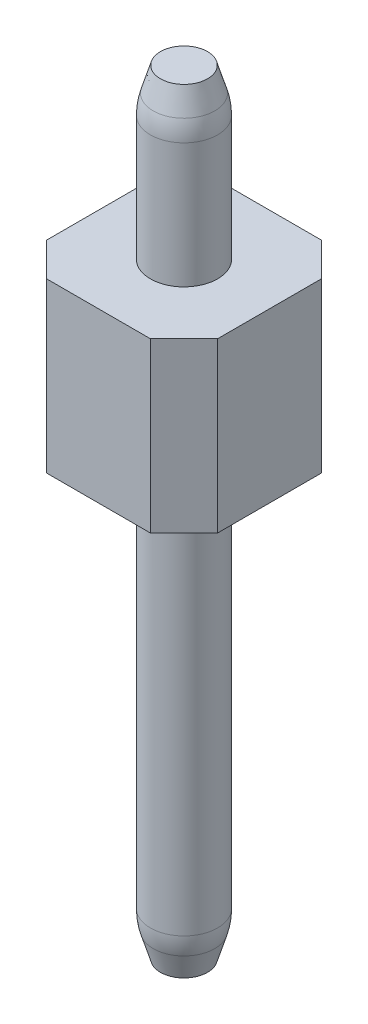
from build123d import *
from OCP.BRepFilletAPI import BRepFilletAPI_MakeChamfer

# Parameters (mm, degrees)
SKETCH1_R               = 0.5
BOSS_EXTRUDE1_DEPTH     = 11.5
BOSS_EXTRUDE1_2_DEPTH   = 11.5
BOSS_EXTRUDE1_3_DEPTH   = 11.5
BOSS_EXTRUDE1_4_DEPTH   = 11.5
BOSS_EXTRUDE1_5_DEPTH   = 11.5
BOSS_EXTRUDE1_6_DEPTH   = 11.5
BOSS_EXTRUDE1_7_DEPTH   = 11.5
BOSS_EXTRUDE1_8_DEPTH   = 11.5
BOSS_EXTRUDE1_9_DEPTH   = 11.5
BOSS_EXTRUDE1_10_DEPTH  = 11.5
BOSS_EXTRUDE1_11_DEPTH  = 11.5
BOSS_EXTRUDE1_12_DEPTH  = 11.5
BOSS_EXTRUDE1_13_DEPTH  = 11.5
BOSS_EXTRUDE1_14_DEPTH  = 11.5
BOSS_EXTRUDE1_15_DEPTH  = 11.5
BOSS_EXTRUDE1_16_DEPTH  = 11.5
BOSS_EXTRUDE2_DEPTH     = 2.5
CHAMFER1_SIZE           = 0.5
CHAMFER1_SIZE2          = 0.15
FILLET1_R               = 1
CHAMFER2_SIZE           = 0.15
CHAMFER2_SIZE2          = 0.5
FILLET2_R               = 1
CUT_EXTRUDE1_DEPTH      = 42.093776929
CUT_EXTRUDE1_DEPTH_BACK = 42.093776929
SKETCH3_W               = 38.1
SKETCH3_H               = 11.5


with BuildPart() as part:
    # Sketch1 → Boss-Extrude1 (new body)
    with BuildSketch(Plane(origin=(0, 0, 0), x_dir=(1, 0, 0), z_dir=(0, 1, 0))):
        Circle(SKETCH1_R)
    extrude(amount=BOSS_EXTRUDE1_DEPTH)



with BuildPart() as body_2:
    # Sketch1 → Boss-Extrude1 2 (new body)
    with BuildSketch(Plane(origin=(0, 0, 0), x_dir=(1, 0, 0), z_dir=(0, 1, 0))):
        with Locations((2.54, 0)):
            Circle(SKETCH1_R)
    extrude(amount=BOSS_EXTRUDE1_2_DEPTH)


with BuildPart() as body_3:
    # Sketch1 → Boss-Extrude1 3 (new body)
    with BuildSketch(Plane(origin=(0, 0, 0), x_dir=(1, 0, 0), z_dir=(0, 1, 0))):
        with Locations((5.08, 0)):
            Circle(SKETCH1_R)
    extrude(amount=BOSS_EXTRUDE1_3_DEPTH)


with BuildPart() as body_4:
    # Sketch1 → Boss-Extrude1 4 (new body)
    with BuildSketch(Plane(origin=(0, 0, 0), x_dir=(1, 0, 0), z_dir=(0, 1, 0))):
        with Locations((7.62, 0)):
            Circle(SKETCH1_R)
    extrude(amount=BOSS_EXTRUDE1_4_DEPTH)


with BuildPart() as body_5:
    # Sketch1 → Boss-Extrude1 5 (new body)
    with BuildSketch(Plane(origin=(0, 0, 0), x_dir=(1, 0, 0), z_dir=(0, 1, 0))):
        with Locations((10.16, 0)):
            Circle(SKETCH1_R)
    extrude(amount=BOSS_EXTRUDE1_5_DEPTH)


with BuildPart() as body_6:
    # Sketch1 → Boss-Extrude1 6 (new body)
    with BuildSketch(Plane(origin=(0, 0, 0), x_dir=(1, 0, 0), z_dir=(0, 1, 0))):
        with Locations((12.7, 0)):
            Circle(SKETCH1_R)
    extrude(amount=BOSS_EXTRUDE1_6_DEPTH)


with BuildPart() as body_7:
    # Sketch1 → Boss-Extrude1 7 (new body)
    with BuildSketch(Plane(origin=(0, 0, 0), x_dir=(1, 0, 0), z_dir=(0, 1, 0))):
        with Locations((15.24, 0)):
            Circle(SKETCH1_R)
    extrude(amount=BOSS_EXTRUDE1_7_DEPTH)


with BuildPart() as body_8:
    # Sketch1 → Boss-Extrude1 8 (new body)
    with BuildSketch(Plane(origin=(0, 0, 0), x_dir=(1, 0, 0), z_dir=(0, 1, 0))):
        with Locations((17.78, 0)):
            Circle(SKETCH1_R)
    extrude(amount=BOSS_EXTRUDE1_8_DEPTH)


with BuildPart() as body_9:
    # Sketch1 → Boss-Extrude1 9 (new body)
    with BuildSketch(Plane(origin=(0, 0, 0), x_dir=(1, 0, 0), z_dir=(0, 1, 0))):
        with Locations((20.32, 0)):
            Circle(SKETCH1_R)
    extrude(amount=BOSS_EXTRUDE1_9_DEPTH)


with BuildPart() as body_10:
    # Sketch1 → Boss-Extrude1 10 (new body)
    with BuildSketch(Plane(origin=(0, 0, 0), x_dir=(1, 0, 0), z_dir=(0, 1, 0))):
        with Locations((22.86, 0)):
            Circle(SKETCH1_R)
    extrude(amount=BOSS_EXTRUDE1_10_DEPTH)


with BuildPart() as body_11:
    # Sketch1 → Boss-Extrude1 11 (new body)
    with BuildSketch(Plane(origin=(0, 0, 0), x_dir=(1, 0, 0), z_dir=(0, 1, 0))):
        with Locations((25.4, 0)):
            Circle(SKETCH1_R)
    extrude(amount=BOSS_EXTRUDE1_11_DEPTH)


with BuildPart() as body_12:
    # Sketch1 → Boss-Extrude1 12 (new body)
    with BuildSketch(Plane(origin=(0, 0, 0), x_dir=(1, 0, 0), z_dir=(0, 1, 0))):
        with Locations((27.94, 0)):
            Circle(SKETCH1_R)
    extrude(amount=BOSS_EXTRUDE1_12_DEPTH)


with BuildPart() as body_13:
    # Sketch1 → Boss-Extrude1 13 (new body)
    with BuildSketch(Plane(origin=(0, 0, 0), x_dir=(1, 0, 0), z_dir=(0, 1, 0))):
        with Locations((30.48, 0)):
            Circle(SKETCH1_R)
    extrude(amount=BOSS_EXTRUDE1_13_DEPTH)


with BuildPart() as body_14:
    # Sketch1 → Boss-Extrude1 14 (new body)
    with BuildSketch(Plane(origin=(0, 0, 0), x_dir=(1, 0, 0), z_dir=(0, 1, 0))):
        with Locations((33.02, 0)):
            Circle(SKETCH1_R)
    extrude(amount=BOSS_EXTRUDE1_14_DEPTH)


with BuildPart() as body_15:
    # Sketch1 → Boss-Extrude1 15 (new body)
    with BuildSketch(Plane(origin=(0, 0, 0), x_dir=(1, 0, 0), z_dir=(0, 1, 0))):
        with Locations((35.56, 0)):
            Circle(SKETCH1_R)
    extrude(amount=BOSS_EXTRUDE1_15_DEPTH)


with BuildPart() as body_16:
    # Sketch1 → Boss-Extrude1 16 (new body)
    with BuildSketch(Plane(origin=(0, 0, 0), x_dir=(1, 0, 0), z_dir=(0, 1, 0))):
        with Locations((38.1, 0)):
            Circle(SKETCH1_R)
    extrude(amount=BOSS_EXTRUDE1_16_DEPTH)


with BuildPart() as part_1:
    add(part.part)

    add(body_2.part)  # Boss-Extrude2 merges body 2

    add(body_3.part)  # Boss-Extrude2 merges body 3

    add(body_4.part)  # Boss-Extrude2 merges body 4

    add(body_5.part)  # Boss-Extrude2 merges body 5

    add(body_6.part)  # Boss-Extrude2 merges body 6

    add(body_7.part)  # Boss-Extrude2 merges body 7

    add(body_8.part)  # Boss-Extrude2 merges body 8

    add(body_9.part)  # Boss-Extrude2 merges body 9

    add(body_10.part)  # Boss-Extrude2 merges body 10

    add(body_11.part)  # Boss-Extrude2 merges body 11

    add(body_12.part)  # Boss-Extrude2 merges body 12

    add(body_13.part)  # Boss-Extrude2 merges body 13

    add(body_14.part)  # Boss-Extrude2 merges body 14

    add(body_15.part)  # Boss-Extrude2 merges body 15

    add(body_16.part)  # Boss-Extrude2 merges body 16
    # Sketch2 → Boss-Extrude2 (add)
    with BuildSketch(Plane(origin=(0, 6.5, 0), x_dir=(1, 0, 0), z_dir=(0, 1, 0))):
        Polygon((-1.27, 0.77), (-0.77, 1.27), (0.77, 1.27), (1.27, 0.77), (1.77, 1.27), (3.31, 1.27), (3.81, 0.77), (4.31, 1.27), (5.85, 1.27), (6.35, 0.77), (6.85, 1.27), (8.39, 1.27), (8.89, 0.77), (9.39, 1.27), (10.93, 1.27), (11.43, 0.77), (11.93, 1.27), (13.47, 1.27), (13.97, 0.77), (14.47, 1.27), (16.01, 1.27), (16.51, 0.77), (17.01, 1.27), (18.55, 1.27), (19.05, 0.77), (19.55, 1.27), (21.09, 1.27), (21.59, 0.77), (22.09, 1.27), (23.63, 1.27), (24.13, 0.77), (24.63, 1.27), (26.17, 1.27), (26.67, 0.77), (27.17, 1.27), (28.71, 1.27), (29.21, 0.77), (29.71, 1.27), (31.25, 1.27), (31.75, 0.77), (32.25, 1.27), (33.79, 1.27), (34.29, 0.77), (34.79, 1.27), (36.33, 1.27), (36.83, 0.77), (37.33, 1.27), (38.87, 1.27), (39.37, 0.77), (39.37, -0.77), (38.87, -1.27), (37.33, -1.27), (36.83, -0.77), (36.33, -1.27), (34.79, -1.27), (34.29, -0.77), (33.79, -1.27), (32.25, -1.27), (31.75, -0.77), (31.25, -1.27), (29.71, -1.27), (29.21, -0.77), (28.71, -1.27), (27.17, -1.27), (26.67, -0.77), (26.17, -1.27), (24.63, -1.27), (24.13, -0.77), (23.63, -1.27), (22.09, -1.27), (21.59, -0.77), (21.09, -1.27), (19.55, -1.27), (19.05, -0.77), (18.55, -1.27), (17.01, -1.27), (16.51, -0.77), (16.01, -1.27), (14.47, -1.27), (13.97, -0.77), (13.47, -1.27), (11.93, -1.27), (11.43, -0.77), (10.93, -1.27), (9.39, -1.27), (8.89, -0.77), (8.39, -1.27), (6.85, -1.27), (6.35, -0.77), (5.85, -1.27), (4.31, -1.27), (3.81, -0.77), (3.31, -1.27), (1.77, -1.27), (1.27, -0.77), (0.77, -1.27), (-0.77, -1.27), (-1.27, -0.77), align=None)
    extrude(amount=BOSS_EXTRUDE2_DEPTH)

    # Chamfer1: one chamfer whose edges measure the first distance from different faces: ONE call of the kernel's chamfer builder (chamfer() names one face for all edges)
    chamfer1_edges_1 = [part_1.edges().sort_by_distance(p)[0] for p in [
        (14.74, 11.5, 0),
    ]]
    chamfer1_side_1 = [part_1.faces().sort_by_distance(p)[0] for p in [
        (14.74, 10.25, 0),
    ]]
    chamfer1_edges_2 = [part_1.edges().sort_by_distance(p)[0] for p in [
        (12.2, 11.5, 0),
    ]]
    chamfer1_side_2 = [part_1.faces().sort_by_distance(p)[0] for p in [
        (12.2, 10.25, 0),
    ]]
    chamfer1_edges_3 = [part_1.edges().sort_by_distance(p)[0] for p in [
        (9.66, 11.5, 0),
    ]]
    chamfer1_side_3 = [part_1.faces().sort_by_distance(p)[0] for p in [
        (9.66, 10.25, 0),
    ]]
    chamfer1_edges_4 = [part_1.edges().sort_by_distance(p)[0] for p in [
        (7.12, 11.5, 0),
    ]]
    chamfer1_side_4 = [part_1.faces().sort_by_distance(p)[0] for p in [
        (7.12, 10.25, 0),
    ]]
    chamfer1_edges_5 = [part_1.edges().sort_by_distance(p)[0] for p in [
        (4.58, 11.5, 0),
    ]]
    chamfer1_side_5 = [part_1.faces().sort_by_distance(p)[0] for p in [
        (4.58, 10.25, 0),
    ]]
    chamfer1_edges_6 = [part_1.edges().sort_by_distance(p)[0] for p in [
        (2.04, 11.5, 0),
    ]]
    chamfer1_side_6 = [part_1.faces().sort_by_distance(p)[0] for p in [
        (2.04, 10.25, 0),
    ]]
    chamfer1_edges_7 = [part_1.edges().sort_by_distance(p)[0] for p in [
        (-0.5, 11.5, 0),
    ]]
    chamfer1_side_7 = [part_1.faces().sort_by_distance(p)[0] for p in [
        (-0.5, 10.25, 0),
    ]]
    chamfer1_edges_8 = [part_1.edges().sort_by_distance(p)[0] for p in [
        (37.6, 11.5, 0),
    ]]
    chamfer1_side_8 = [part_1.faces().sort_by_distance(p)[0] for p in [
        (37.6, 10.25, 0),
    ]]
    chamfer1_edges_9 = [part_1.edges().sort_by_distance(p)[0] for p in [
        (35.06, 11.5, 0),
    ]]
    chamfer1_side_9 = [part_1.faces().sort_by_distance(p)[0] for p in [
        (35.06, 10.25, 0),
    ]]
    chamfer1_edges_10 = [part_1.edges().sort_by_distance(p)[0] for p in [
        (32.52, 11.5, 0),
    ]]
    chamfer1_side_10 = [part_1.faces().sort_by_distance(p)[0] for p in [
        (32.52, 10.25, 0),
    ]]
    chamfer1_edges_11 = [part_1.edges().sort_by_distance(p)[0] for p in [
        (29.98, 11.5, 0),
    ]]
    chamfer1_side_11 = [part_1.faces().sort_by_distance(p)[0] for p in [
        (29.98, 10.25, 0),
    ]]
    chamfer1_edges_12 = [part_1.edges().sort_by_distance(p)[0] for p in [
        (27.44, 11.5, 0),
    ]]
    chamfer1_side_12 = [part_1.faces().sort_by_distance(p)[0] for p in [
        (27.44, 10.25, 0),
    ]]
    chamfer1_edges_13 = [part_1.edges().sort_by_distance(p)[0] for p in [
        (24.9, 11.5, 0),
    ]]
    chamfer1_side_13 = [part_1.faces().sort_by_distance(p)[0] for p in [
        (24.9, 10.25, 0),
    ]]
    chamfer1_edges_14 = [part_1.edges().sort_by_distance(p)[0] for p in [
        (22.36, 11.5, 0),
    ]]
    chamfer1_side_14 = [part_1.faces().sort_by_distance(p)[0] for p in [
        (22.36, 10.25, 0),
    ]]
    chamfer1_edges_15 = [part_1.edges().sort_by_distance(p)[0] for p in [
        (19.82, 11.5, 0),
    ]]
    chamfer1_side_15 = [part_1.faces().sort_by_distance(p)[0] for p in [
        (19.82, 10.25, 0),
    ]]
    chamfer1_edges_16 = [part_1.edges().sort_by_distance(p)[0] for p in [
        (17.28, 11.5, 0),
    ]]
    chamfer1_side_16 = [part_1.faces().sort_by_distance(p)[0] for p in [
        (17.28, 10.25, 0),
    ]]
    chamfer1 = BRepFilletAPI_MakeChamfer(part_1.part.solid().wrapped)
    for e in chamfer1_edges_1:
        chamfer1.Add(CHAMFER1_SIZE, CHAMFER1_SIZE2, e.wrapped, chamfer1_side_1[0].wrapped)  # the first distance lies on this face
    for e in chamfer1_edges_2:
        chamfer1.Add(CHAMFER1_SIZE, CHAMFER1_SIZE2, e.wrapped, chamfer1_side_2[0].wrapped)  # the first distance lies on this face
    for e in chamfer1_edges_3:
        chamfer1.Add(CHAMFER1_SIZE, CHAMFER1_SIZE2, e.wrapped, chamfer1_side_3[0].wrapped)  # the first distance lies on this face
    for e in chamfer1_edges_4:
        chamfer1.Add(CHAMFER1_SIZE, CHAMFER1_SIZE2, e.wrapped, chamfer1_side_4[0].wrapped)  # the first distance lies on this face
    for e in chamfer1_edges_5:
        chamfer1.Add(CHAMFER1_SIZE, CHAMFER1_SIZE2, e.wrapped, chamfer1_side_5[0].wrapped)  # the first distance lies on this face
    for e in chamfer1_edges_6:
        chamfer1.Add(CHAMFER1_SIZE, CHAMFER1_SIZE2, e.wrapped, chamfer1_side_6[0].wrapped)  # the first distance lies on this face
    for e in chamfer1_edges_7:
        chamfer1.Add(CHAMFER1_SIZE, CHAMFER1_SIZE2, e.wrapped, chamfer1_side_7[0].wrapped)  # the first distance lies on this face
    for e in chamfer1_edges_8:
        chamfer1.Add(CHAMFER1_SIZE, CHAMFER1_SIZE2, e.wrapped, chamfer1_side_8[0].wrapped)  # the first distance lies on this face
    for e in chamfer1_edges_9:
        chamfer1.Add(CHAMFER1_SIZE, CHAMFER1_SIZE2, e.wrapped, chamfer1_side_9[0].wrapped)  # the first distance lies on this face
    for e in chamfer1_edges_10:
        chamfer1.Add(CHAMFER1_SIZE, CHAMFER1_SIZE2, e.wrapped, chamfer1_side_10[0].wrapped)  # the first distance lies on this face
    for e in chamfer1_edges_11:
        chamfer1.Add(CHAMFER1_SIZE, CHAMFER1_SIZE2, e.wrapped, chamfer1_side_11[0].wrapped)  # the first distance lies on this face
    for e in chamfer1_edges_12:
        chamfer1.Add(CHAMFER1_SIZE, CHAMFER1_SIZE2, e.wrapped, chamfer1_side_12[0].wrapped)  # the first distance lies on this face
    for e in chamfer1_edges_13:
        chamfer1.Add(CHAMFER1_SIZE, CHAMFER1_SIZE2, e.wrapped, chamfer1_side_13[0].wrapped)  # the first distance lies on this face
    for e in chamfer1_edges_14:
        chamfer1.Add(CHAMFER1_SIZE, CHAMFER1_SIZE2, e.wrapped, chamfer1_side_14[0].wrapped)  # the first distance lies on this face
    for e in chamfer1_edges_15:
        chamfer1.Add(CHAMFER1_SIZE, CHAMFER1_SIZE2, e.wrapped, chamfer1_side_15[0].wrapped)  # the first distance lies on this face
    for e in chamfer1_edges_16:
        chamfer1.Add(CHAMFER1_SIZE, CHAMFER1_SIZE2, e.wrapped, chamfer1_side_16[0].wrapped)  # the first distance lies on this face
    add(Compound.cast(chamfer1.Shape()), mode=Mode.REPLACE)

    # Fillet1
    fillet1_edges = [part_1.edges().sort_by_distance(p)[0] for p in [
        (37.6, 11, 0),
        (35.06, 11, 0),
        (32.52, 11, 0),
        (29.98, 11, 0),
        (27.44, 11, 0),
        (24.9, 11, 0),
        (22.36, 11, 0),
        (19.82, 11, 0),
        (17.28, 11, 0),
        (14.74, 11, 0),
        (12.2, 11, 0),
        (9.66, 11, 0),
        (7.12, 11, 0),
        (4.58, 11, 0),
        (2.04, 11, 0),
        (-0.5, 11, 0),
    ]]
    fillet(fillet1_edges, radius=FILLET1_R)

    # Chamfer2: one chamfer whose edges measure the first distance from different faces: ONE call of the kernel's chamfer builder (chamfer() names one face for all edges)
    chamfer2_edges_1 = [part_1.edges().sort_by_distance(p)[0] for p in [
        (9.66, 0, 0),
    ]]
    chamfer2_side_1 = [part_1.faces().sort_by_distance(p)[0] for p in [
        (10.16, 0, 0),
    ]]
    chamfer2_edges_2 = [part_1.edges().sort_by_distance(p)[0] for p in [
        (17.28, 0, 0),
    ]]
    chamfer2_side_2 = [part_1.faces().sort_by_distance(p)[0] for p in [
        (17.78, 0, 0),
    ]]
    chamfer2_edges_3 = [part_1.edges().sort_by_distance(p)[0] for p in [
        (22.36, 0, 0),
    ]]
    chamfer2_side_3 = [part_1.faces().sort_by_distance(p)[0] for p in [
        (22.86, 0, 0),
    ]]
    chamfer2_edges_4 = [part_1.edges().sort_by_distance(p)[0] for p in [
        (27.44, 0, 0),
    ]]
    chamfer2_side_4 = [part_1.faces().sort_by_distance(p)[0] for p in [
        (27.94, 0, 0),
    ]]
    chamfer2_edges_5 = [part_1.edges().sort_by_distance(p)[0] for p in [
        (29.98, 0, 0),
    ]]
    chamfer2_side_5 = [part_1.faces().sort_by_distance(p)[0] for p in [
        (30.48, 0, 0),
    ]]
    chamfer2_edges_6 = [part_1.edges().sort_by_distance(p)[0] for p in [
        (-0.5, 0, 0),
    ]]
    chamfer2_side_6 = [part_1.faces().sort_by_distance(p)[0] for p in [
        (0, 0, 0),
    ]]
    chamfer2_edges_7 = [part_1.edges().sort_by_distance(p)[0] for p in [
        (2.04, 0, 0),
    ]]
    chamfer2_side_7 = [part_1.faces().sort_by_distance(p)[0] for p in [
        (2.54, 0, 0),
    ]]
    chamfer2_edges_8 = [part_1.edges().sort_by_distance(p)[0] for p in [
        (4.58, 0, 0),
    ]]
    chamfer2_side_8 = [part_1.faces().sort_by_distance(p)[0] for p in [
        (5.08, 0, 0),
    ]]
    chamfer2_edges_9 = [part_1.edges().sort_by_distance(p)[0] for p in [
        (7.12, 0, 0),
    ]]
    chamfer2_side_9 = [part_1.faces().sort_by_distance(p)[0] for p in [
        (7.62, 0, 0),
    ]]
    chamfer2_edges_10 = [part_1.edges().sort_by_distance(p)[0] for p in [
        (12.2, 0, 0),
    ]]
    chamfer2_side_10 = [part_1.faces().sort_by_distance(p)[0] for p in [
        (12.7, 0, 0),
    ]]
    chamfer2_edges_11 = [part_1.edges().sort_by_distance(p)[0] for p in [
        (14.74, 0, 0),
    ]]
    chamfer2_side_11 = [part_1.faces().sort_by_distance(p)[0] for p in [
        (15.24, 0, 0),
    ]]
    chamfer2_edges_12 = [part_1.edges().sort_by_distance(p)[0] for p in [
        (19.82, 0, 0),
    ]]
    chamfer2_side_12 = [part_1.faces().sort_by_distance(p)[0] for p in [
        (20.32, 0, 0),
    ]]
    chamfer2_edges_13 = [part_1.edges().sort_by_distance(p)[0] for p in [
        (24.9, 0, 0),
    ]]
    chamfer2_side_13 = [part_1.faces().sort_by_distance(p)[0] for p in [
        (25.4, 0, 0),
    ]]
    chamfer2_edges_14 = [part_1.edges().sort_by_distance(p)[0] for p in [
        (32.52, 0, 0),
    ]]
    chamfer2_side_14 = [part_1.faces().sort_by_distance(p)[0] for p in [
        (33.02, 0, 0),
    ]]
    chamfer2_edges_15 = [part_1.edges().sort_by_distance(p)[0] for p in [
        (35.06, 0, 0),
    ]]
    chamfer2_side_15 = [part_1.faces().sort_by_distance(p)[0] for p in [
        (35.56, 0, 0),
    ]]
    chamfer2_edges_16 = [part_1.edges().sort_by_distance(p)[0] for p in [
        (37.6, 0, 0),
    ]]
    chamfer2_side_16 = [part_1.faces().sort_by_distance(p)[0] for p in [
        (38.1, 0, 0),
    ]]
    chamfer2 = BRepFilletAPI_MakeChamfer(part_1.part.solid().wrapped)
    for e in chamfer2_edges_1:
        chamfer2.Add(CHAMFER2_SIZE, CHAMFER2_SIZE2, e.wrapped, chamfer2_side_1[0].wrapped)  # the first distance lies on this face
    for e in chamfer2_edges_2:
        chamfer2.Add(CHAMFER2_SIZE, CHAMFER2_SIZE2, e.wrapped, chamfer2_side_2[0].wrapped)  # the first distance lies on this face
    for e in chamfer2_edges_3:
        chamfer2.Add(CHAMFER2_SIZE, CHAMFER2_SIZE2, e.wrapped, chamfer2_side_3[0].wrapped)  # the first distance lies on this face
    for e in chamfer2_edges_4:
        chamfer2.Add(CHAMFER2_SIZE, CHAMFER2_SIZE2, e.wrapped, chamfer2_side_4[0].wrapped)  # the first distance lies on this face
    for e in chamfer2_edges_5:
        chamfer2.Add(CHAMFER2_SIZE, CHAMFER2_SIZE2, e.wrapped, chamfer2_side_5[0].wrapped)  # the first distance lies on this face
    for e in chamfer2_edges_6:
        chamfer2.Add(CHAMFER2_SIZE, CHAMFER2_SIZE2, e.wrapped, chamfer2_side_6[0].wrapped)  # the first distance lies on this face
    for e in chamfer2_edges_7:
        chamfer2.Add(CHAMFER2_SIZE, CHAMFER2_SIZE2, e.wrapped, chamfer2_side_7[0].wrapped)  # the first distance lies on this face
    for e in chamfer2_edges_8:
        chamfer2.Add(CHAMFER2_SIZE, CHAMFER2_SIZE2, e.wrapped, chamfer2_side_8[0].wrapped)  # the first distance lies on this face
    for e in chamfer2_edges_9:
        chamfer2.Add(CHAMFER2_SIZE, CHAMFER2_SIZE2, e.wrapped, chamfer2_side_9[0].wrapped)  # the first distance lies on this face
    for e in chamfer2_edges_10:
        chamfer2.Add(CHAMFER2_SIZE, CHAMFER2_SIZE2, e.wrapped, chamfer2_side_10[0].wrapped)  # the first distance lies on this face
    for e in chamfer2_edges_11:
        chamfer2.Add(CHAMFER2_SIZE, CHAMFER2_SIZE2, e.wrapped, chamfer2_side_11[0].wrapped)  # the first distance lies on this face
    for e in chamfer2_edges_12:
        chamfer2.Add(CHAMFER2_SIZE, CHAMFER2_SIZE2, e.wrapped, chamfer2_side_12[0].wrapped)  # the first distance lies on this face
    for e in chamfer2_edges_13:
        chamfer2.Add(CHAMFER2_SIZE, CHAMFER2_SIZE2, e.wrapped, chamfer2_side_13[0].wrapped)  # the first distance lies on this face
    for e in chamfer2_edges_14:
        chamfer2.Add(CHAMFER2_SIZE, CHAMFER2_SIZE2, e.wrapped, chamfer2_side_14[0].wrapped)  # the first distance lies on this face
    for e in chamfer2_edges_15:
        chamfer2.Add(CHAMFER2_SIZE, CHAMFER2_SIZE2, e.wrapped, chamfer2_side_15[0].wrapped)  # the first distance lies on this face
    for e in chamfer2_edges_16:
        chamfer2.Add(CHAMFER2_SIZE, CHAMFER2_SIZE2, e.wrapped, chamfer2_side_16[0].wrapped)  # the first distance lies on this face
    add(Compound.cast(chamfer2.Shape()), mode=Mode.REPLACE)

    # Fillet2
    fillet2_edges = [part_1.edges().sort_by_distance(p)[0] for p in [
        (29.98, 0.5, 0),
        (32.52, 0.5, 0),
        (35.06, 0.5, 0),
        (37.6, 0.5, 0),
        (27.44, 0.5, 0),
        (24.9, 0.5, 0),
        (22.36, 0.5, 0),
        (19.82, 0.5, 0),
        (17.28, 0.5, 0),
        (14.74, 0.5, 0),
        (12.2, 0.5, 0),
        (9.66, 0.5, 0),
        (7.12, 0.5, 0),
        (4.58, 0.5, 0),
        (2.04, 0.5, 0),
        (-0.5, 0.5, 0),
    ]]
    fillet(fillet2_edges, radius=FILLET2_R)

    # Sketch3 → Cut-Extrude1 (cut, two sides: drawn at the far end of the back side and taken through both)
    with BuildSketch(Plane.XY.offset(1.27).offset(-CUT_EXTRUDE1_DEPTH_BACK)):
        with Locations((20.32, 5.75)):
            Rectangle(SKETCH3_W, SKETCH3_H)
    extrude(amount=CUT_EXTRUDE1_DEPTH + CUT_EXTRUDE1_DEPTH_BACK, mode=Mode.SUBTRACT)


solid = part_1.part
